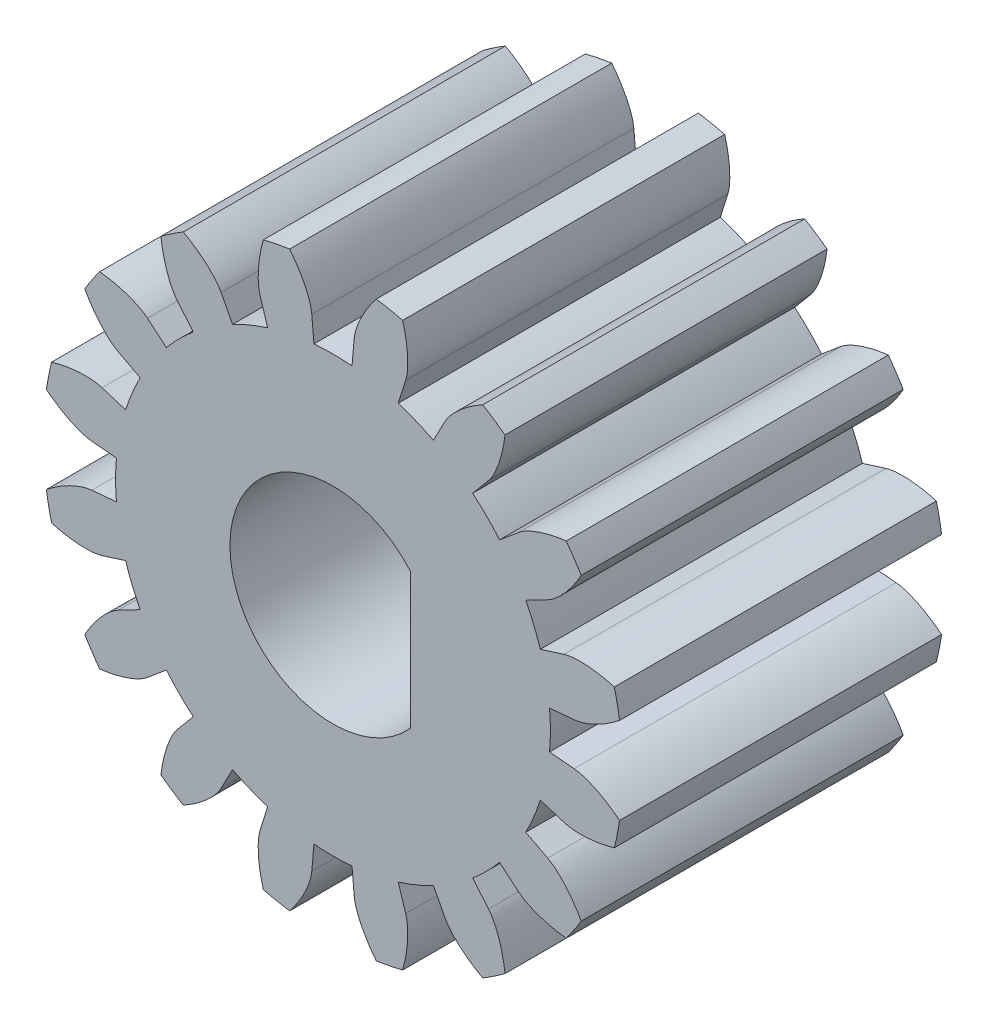
from build123d import *

# Parameters (mm, degrees)
SKETCH_1_R               = 4.5
SKETCH_1_R_2             = 1.5
EXTRUDE_1_DEPTH          = 5
CUT_EXTRUDE_1_DEPTH      = 9.093207028
PATTERN_CIRCULAR_1_DEPTH = 5
SKETCH_2_R               = 1.6
EXTRUDE_2_DEPTH          = 5
CUT_EXTRUDE_2_DEPTH      = 9.037177216


# Read off the part's stored shape, not the designer's step: 阵列(圆周)1
with BuildPart() as part:
    # 草图1 → 凸台-拉伸1 (new body)
    with BuildSketch(Plane.XY):
        Circle(SKETCH_1_R)
        Circle(SKETCH_1_R_2, mode=Mode.SUBTRACT)
    extrude(amount=EXTRUDE_1_DEPTH)

    # 草图1<3> → 切除-拉伸1 (cut, through all)
    with BuildSketch(Plane.XY):
        with BuildLine():
            Line((3.744337803, 0.329074401), (3.362040897, 0.295475903))
            ThreePointArc((3.362040897, 0.295475903), (3.371758668, 0.147879975), (3.375, 0))
            ThreePointArc((3.375, 0), (3.371758668, -0.147879975), (3.362040897, -0.295475903))
            Line((3.362040897, -0.295475903), (3.744337803, -0.329074401))
            add(Edge.make_bspline(
                [(3.744337803, -0.329074401), (3.772879878, -0.331582846), (3.852010051, -0.344515168), (3.998053748, -0.392622231), (4.176593354, -0.48016265), (4.319250266, -0.572875861), (4.413779393, -0.643953083), (4.449506423, -0.672229565)],
                knots=[0, 0, 0, 0, 0, 0.005604068, 0.015718248, 0.029959916, 0.038889728, 0.038889728, 0.038889728, 0.038889728, 0.038889728], degree=4))
            ThreePointArc((4.449506423, -0.672229565), (4.48735885, -0.337061637), (4.5, 0))
            ThreePointArc((4.5, 0), (4.48735885, 0.337061637), (4.449506423, 0.672229565))
            add(Edge.make_bspline(
                [(3.744337803, 0.329074401), (3.772879878, 0.331582846), (3.852010051, 0.344515168), (3.998053748, 0.392622231), (4.176593354, 0.48016265), (4.319250266, 0.572875861), (4.413779393, 0.643953083), (4.449506423, 0.672229565)],
                knots=[0, 0, 0, 0, 0, 0.005604068, 0.015718248, 0.029959916, 0.038889728, 0.038889728, 0.038889728, 0.038889728, 0.038889728], degree=4))
        make_face()
    extrude(amount=CUT_EXTRUDE_1_DEPTH, mode=Mode.SUBTRACT)

    # 阵列(圆周)1 outline → 阵列(圆周)1 (cut)
    with BuildSketch(Plane.XY):
        with BuildLine():
            Line((3.219194505, 1.013613211), (3.58524838, 1.128870939))
            add(Edge.make_bspline(
                [(3.58524838, 1.128870939), (3.612577759, 1.137476016), (3.690633492, 1.155809915), (3.843970051, 1.167253287), (4.042419406, 1.154700636), (4.209697017, 1.123637234), (4.324230618, 1.094145175), (4.368059032, 1.081693254)],
                knots=[0, 0, 0, 0, 0, 0.005604068, 0.015718248, 0.029959916, 0.038889728, 0.038889728, 0.038889728, 0.038889728, 0.038889728], degree=4))
            ThreePointArc((4.368059032, 1.081693254), (4.157457896, 1.722075445), (3.853556797, 2.323811526))
            add(Edge.make_bspline(
                [(3.333385738, 1.736921146), (3.358795236, 1.750161226), (3.426952998, 1.79239094), (3.543470004, 1.892724575), (3.674918824, 2.041925525), (3.771236815, 2.1821738), (3.831370266, 2.284015321), (3.853556797, 2.323811526)],
                knots=[0, 0, 0, 0, 0, 0.005604068, 0.015718248, 0.029959916, 0.038889728, 0.038889728, 0.038889728, 0.038889728, 0.038889728], degree=4))
            Line((3.333385738, 1.736921146), (2.993047039, 1.559581489))
            ThreePointArc((2.993047039, 1.559581489), (3.118093422, 1.291556584), (3.219194505, 1.013613211))
        make_face()
        with BuildLine():
            add(Edge.make_bspline(
                [(3.333385738, -1.736921146), (3.358795236, -1.750161226), (3.426952998, -1.79239094), (3.543470004, -1.892724575), (3.674918824, -2.041925525), (3.771236815, -2.1821738), (3.831370266, -2.284015321), (3.853556797, -2.323811527)],
                knots=[0, 0, 0, 0, 0, 0.005604068, 0.015718248, 0.029959916, 0.038889728, 0.038889728, 0.038889728, 0.038889728, 0.038889728], degree=4))
            ThreePointArc((3.853556797, -2.323811527), (4.157457896, -1.722075445), (4.368059031, -1.081693254))
            add(Edge.make_bspline(
                [(3.58524838, -1.128870939), (3.612577759, -1.137476016), (3.690633492, -1.155809915), (3.843970051, -1.167253287), (4.042419406, -1.154700636), (4.209697017, -1.123637234), (4.324230618, -1.094145175), (4.368059031, -1.081693254)],
                knots=[0, 0, 0, 0, 0, 0.005604068, 0.015718248, 0.029959916, 0.038889728, 0.038889728, 0.038889728, 0.038889728, 0.038889728], degree=4))
            Line((3.58524838, -1.128870939), (3.219194505, -1.013613211))
            ThreePointArc((3.219194505, -1.013613211), (3.118093422, -1.291556584), (2.993047039, -1.559581489))
            Line((2.993047039, -1.559581489), (3.333385738, -1.736921146))
        make_face()
        with BuildLine():
            add(Edge.make_bspline(
                [(2.414955911, -2.880337392), (2.433364467, -2.902293425), (2.480173417, -2.96739144), (2.549425074, -3.104676759), (2.613771217, -3.292823749), (2.649086746, -3.459255559), (2.665669748, -3.576356931), (2.670938081, -3.621614249)],
                knots=[0, 0, 0, 0, 0, 0.005604068, 0.015718248, 0.029959916, 0.038889728, 0.038889728, 0.038889728, 0.038889728, 0.038889728], degree=4))
            ThreePointArc((2.670938081, -3.621614249), (3.181980515, -3.181980515), (3.621614249, -2.670938081))
            add(Edge.make_bspline(
                [(2.880337392, -2.414955911), (2.902293425, -2.433364467), (2.96739144, -2.480173417), (3.104676759, -2.549425074), (3.292823749, -2.613771217), (3.459255559, -2.649086746), (3.576356931, -2.665669748), (3.621614249, -2.670938081)],
                knots=[0, 0, 0, 0, 0, 0.005604068, 0.015718248, 0.029959916, 0.038889728, 0.038889728, 0.038889728, 0.038889728, 0.038889728], degree=4))
            Line((2.880337392, -2.414955911), (2.586254932, -2.168388902))
            ThreePointArc((2.586254932, -2.168388902), (2.386485387, -2.386485387), (2.168388902, -2.586254932))
            Line((2.168388902, -2.586254932), (2.414955911, -2.880337392))
        make_face()
        with BuildLine():
            add(Edge.make_bspline(
                [(1.128870939, -3.58524838), (1.137476016, -3.612577759), (1.155809915, -3.690633492), (1.167253287, -3.843970051), (1.154700636, -4.042419406), (1.123637234, -4.209697017), (1.094145175, -4.324230618), (1.081693254, -4.368059032)],
                knots=[0, 0, 0, 0, 0, 0.005604068, 0.015718248, 0.029959916, 0.038889728, 0.038889728, 0.038889728, 0.038889728, 0.038889728], degree=4))
            ThreePointArc((1.081693254, -4.368059032), (1.722075446, -4.157457896), (2.323811527, -3.853556797))
            add(Edge.make_bspline(
                [(1.736921146, -3.333385738), (1.750161226, -3.358795236), (1.79239094, -3.426952998), (1.892724575, -3.543470004), (2.041925525, -3.674918824), (2.1821738, -3.771236815), (2.284015321, -3.831370266), (2.323811527, -3.853556797)],
                knots=[0, 0, 0, 0, 0, 0.005604068, 0.015718248, 0.029959916, 0.038889728, 0.038889728, 0.038889728, 0.038889728, 0.038889728], degree=4))
            Line((1.736921146, -3.333385738), (1.559581489, -2.993047039))
            ThreePointArc((1.559581489, -2.993047039), (1.291556584, -3.118093422), (1.013613211, -3.219194505))
            Line((1.013613211, -3.219194505), (1.128870939, -3.58524838))
        make_face()
        with BuildLine():
            add(Edge.make_bspline(
                [(-0.329074401, -3.744337803), (-0.331582846, -3.772879878), (-0.344515168, -3.852010051), (-0.392622231, -3.998053748), (-0.48016265, -4.176593354), (-0.572875861, -4.319250266), (-0.643953083, -4.413779393), (-0.672229565, -4.449506423)],
                knots=[0, 0, 0, 0, 0, 0.005604068, 0.015718248, 0.029959916, 0.038889728, 0.038889728, 0.038889728, 0.038889728, 0.038889728], degree=4))
            ThreePointArc((-0.672229565, -4.449506423), (0, -4.5), (0.672229565, -4.449506423))
            add(Edge.make_bspline(
                [(0.329074401, -3.744337803), (0.331582846, -3.772879878), (0.344515168, -3.852010051), (0.392622231, -3.998053748), (0.48016265, -4.176593354), (0.572875861, -4.319250266), (0.643953083, -4.413779393), (0.672229565, -4.449506423)],
                knots=[0, 0, 0, 0, 0, 0.005604068, 0.015718248, 0.029959916, 0.038889728, 0.038889728, 0.038889728, 0.038889728, 0.038889728], degree=4))
            Line((0.329074401, -3.744337803), (0.295475903, -3.362040897))
            ThreePointArc((0.295475903, -3.362040897), (0, -3.375), (-0.295475903, -3.362040897))
            Line((-0.295475903, -3.362040897), (-0.329074401, -3.744337803))
        make_face()
        with BuildLine():
            add(Edge.make_bspline(
                [(-1.736921146, -3.333385738), (-1.750161226, -3.358795236), (-1.79239094, -3.426952998), (-1.892724575, -3.543470004), (-2.041925525, -3.674918824), (-2.1821738, -3.771236815), (-2.284015321, -3.831370266), (-2.323811527, -3.853556797)],
                knots=[0, 0, 0, 0, 0, 0.005604068, 0.015718248, 0.029959916, 0.038889728, 0.038889728, 0.038889728, 0.038889728, 0.038889728], degree=4))
            ThreePointArc((-2.323811527, -3.853556797), (-1.722075446, -4.157457896), (-1.081693254, -4.368059031))
            add(Edge.make_bspline(
                [(-1.128870939, -3.58524838), (-1.137476016, -3.612577759), (-1.155809915, -3.690633492), (-1.167253287, -3.843970051), (-1.154700636, -4.042419406), (-1.123637234, -4.209697017), (-1.094145175, -4.324230618), (-1.081693254, -4.368059031)],
                knots=[0, 0, 0, 0, 0, 0.005604068, 0.015718248, 0.029959916, 0.038889728, 0.038889728, 0.038889728, 0.038889728, 0.038889728], degree=4))
            Line((-1.128870939, -3.58524838), (-1.013613211, -3.219194505))
            ThreePointArc((-1.013613211, -3.219194505), (-1.291556584, -3.118093422), (-1.559581489, -2.993047039))
            Line((-1.559581489, -2.993047039), (-1.736921146, -3.333385738))
        make_face()
        with BuildLine():
            add(Edge.make_bspline(
                [(-2.880337392, -2.414955911), (-2.902293425, -2.433364467), (-2.96739144, -2.480173417), (-3.104676759, -2.549425074), (-3.292823749, -2.613771217), (-3.459255559, -2.649086746), (-3.576356931, -2.665669748), (-3.621614249, -2.670938081)],
                knots=[0, 0, 0, 0, 0, 0.005604068, 0.015718248, 0.029959916, 0.038889728, 0.038889728, 0.038889728, 0.038889728, 0.038889728], degree=4))
            ThreePointArc((-3.621614249, -2.670938081), (-3.181980515, -3.181980515), (-2.670938081, -3.621614249))
            add(Edge.make_bspline(
                [(-2.414955911, -2.880337392), (-2.433364467, -2.902293425), (-2.480173417, -2.96739144), (-2.549425074, -3.104676759), (-2.613771217, -3.292823749), (-2.649086746, -3.459255559), (-2.665669748, -3.576356931), (-2.670938081, -3.621614249)],
                knots=[0, 0, 0, 0, 0, 0.005604068, 0.015718248, 0.029959916, 0.038889728, 0.038889728, 0.038889728, 0.038889728, 0.038889728], degree=4))
            Line((-2.414955911, -2.880337392), (-2.168388902, -2.586254932))
            ThreePointArc((-2.168388902, -2.586254932), (-2.386485387, -2.386485387), (-2.586254932, -2.168388902))
            Line((-2.586254932, -2.168388902), (-2.880337392, -2.414955911))
        make_face()
        with BuildLine():
            add(Edge.make_bspline(
                [(-3.58524838, -1.128870939), (-3.612577759, -1.137476016), (-3.690633492, -1.155809915), (-3.843970051, -1.167253287), (-4.042419406, -1.154700636), (-4.209697017, -1.123637234), (-4.324230618, -1.094145175), (-4.368059032, -1.081693254)],
                knots=[0, 0, 0, 0, 0, 0.005604068, 0.015718248, 0.029959916, 0.038889728, 0.038889728, 0.038889728, 0.038889728, 0.038889728], degree=4))
            ThreePointArc((-4.368059032, -1.081693254), (-4.157457896, -1.722075446), (-3.853556797, -2.323811527))
            add(Edge.make_bspline(
                [(-3.333385738, -1.736921146), (-3.358795236, -1.750161226), (-3.426952998, -1.79239094), (-3.543470004, -1.892724575), (-3.674918824, -2.041925525), (-3.771236815, -2.1821738), (-3.831370266, -2.284015321), (-3.853556797, -2.323811527)],
                knots=[0, 0, 0, 0, 0, 0.005604068, 0.015718248, 0.029959916, 0.038889728, 0.038889728, 0.038889728, 0.038889728, 0.038889728], degree=4))
            Line((-3.333385738, -1.736921146), (-2.993047039, -1.559581489))
            ThreePointArc((-2.993047039, -1.559581489), (-3.118093422, -1.291556584), (-3.219194505, -1.013613211))
            Line((-3.219194505, -1.013613211), (-3.58524838, -1.128870939))
        make_face()
        with BuildLine():
            add(Edge.make_bspline(
                [(-3.744337803, 0.329074401), (-3.772879878, 0.331582846), (-3.852010051, 0.344515168), (-3.998053748, 0.392622231), (-4.176593354, 0.48016265), (-4.319250266, 0.572875861), (-4.413779393, 0.643953083), (-4.449506423, 0.672229565)],
                knots=[0, 0, 0, 0, 0, 0.005604068, 0.015718248, 0.029959916, 0.038889728, 0.038889728, 0.038889728, 0.038889728, 0.038889728], degree=4))
            ThreePointArc((-4.449506423, 0.672229565), (-4.5, 0), (-4.449506423, -0.672229565))
            add(Edge.make_bspline(
                [(-3.744337803, -0.329074401), (-3.772879878, -0.331582846), (-3.852010051, -0.344515168), (-3.998053748, -0.392622231), (-4.176593354, -0.48016265), (-4.319250266, -0.572875861), (-4.413779393, -0.643953083), (-4.449506423, -0.672229565)],
                knots=[0, 0, 0, 0, 0, 0.005604068, 0.015718248, 0.029959916, 0.038889728, 0.038889728, 0.038889728, 0.038889728, 0.038889728], degree=4))
            Line((-3.744337803, -0.329074401), (-3.362040897, -0.295475903))
            ThreePointArc((-3.362040897, -0.295475903), (-3.375, 0), (-3.362040897, 0.295475903))
            Line((-3.362040897, 0.295475903), (-3.744337803, 0.329074401))
        make_face()
        with BuildLine():
            add(Edge.make_bspline(
                [(-3.333385738, 1.736921146), (-3.358795236, 1.750161226), (-3.426952998, 1.79239094), (-3.543470004, 1.892724575), (-3.674918824, 2.041925525), (-3.771236815, 2.1821738), (-3.831370266, 2.284015321), (-3.853556797, 2.323811527)],
                knots=[0, 0, 0, 0, 0, 0.005604068, 0.015718248, 0.029959916, 0.038889728, 0.038889728, 0.038889728, 0.038889728, 0.038889728], degree=4))
            ThreePointArc((-3.853556797, 2.323811527), (-4.157457896, 1.722075446), (-4.368059032, 1.081693254))
            add(Edge.make_bspline(
                [(-3.58524838, 1.128870939), (-3.612577759, 1.137476016), (-3.690633492, 1.155809915), (-3.843970051, 1.167253287), (-4.042419406, 1.154700636), (-4.209697017, 1.123637234), (-4.324230618, 1.094145175), (-4.368059032, 1.081693254)],
                knots=[0, 0, 0, 0, 0, 0.005604068, 0.015718248, 0.029959916, 0.038889728, 0.038889728, 0.038889728, 0.038889728, 0.038889728], degree=4))
            Line((-3.58524838, 1.128870939), (-3.219194505, 1.013613211))
            ThreePointArc((-3.219194505, 1.013613211), (-3.118093422, 1.291556584), (-2.993047039, 1.559581489))
            Line((-2.993047039, 1.559581489), (-3.333385738, 1.736921146))
        make_face()
        with BuildLine():
            add(Edge.make_bspline(
                [(-2.414955911, 2.880337392), (-2.433364467, 2.902293425), (-2.480173417, 2.96739144), (-2.549425074, 3.104676759), (-2.613771217, 3.292823749), (-2.649086746, 3.459255559), (-2.665669748, 3.576356931), (-2.670938081, 3.621614249)],
                knots=[0, 0, 0, 0, 0, 0.005604068, 0.015718248, 0.029959916, 0.038889728, 0.038889728, 0.038889728, 0.038889728, 0.038889728], degree=4))
            ThreePointArc((-2.670938081, 3.621614249), (-3.181980515, 3.181980515), (-3.621614249, 2.670938081))
            add(Edge.make_bspline(
                [(-2.880337392, 2.414955911), (-2.902293425, 2.433364467), (-2.96739144, 2.480173417), (-3.104676759, 2.549425074), (-3.292823749, 2.613771217), (-3.459255559, 2.649086746), (-3.576356931, 2.665669748), (-3.621614249, 2.670938081)],
                knots=[0, 0, 0, 0, 0, 0.005604068, 0.015718248, 0.029959916, 0.038889728, 0.038889728, 0.038889728, 0.038889728, 0.038889728], degree=4))
            Line((-2.880337392, 2.414955911), (-2.586254932, 2.168388902))
            ThreePointArc((-2.586254932, 2.168388902), (-2.386485387, 2.386485387), (-2.168388902, 2.586254932))
            Line((-2.168388902, 2.586254932), (-2.414955911, 2.880337392))
        make_face()
        with BuildLine():
            add(Edge.make_bspline(
                [(-1.128870939, 3.58524838), (-1.137476016, 3.612577759), (-1.155809915, 3.690633492), (-1.167253287, 3.843970051), (-1.154700636, 4.042419406), (-1.123637234, 4.209697017), (-1.094145175, 4.324230618), (-1.081693254, 4.368059032)],
                knots=[0, 0, 0, 0, 0, 0.005604068, 0.015718248, 0.029959916, 0.038889728, 0.038889728, 0.038889728, 0.038889728, 0.038889728], degree=4))
            ThreePointArc((-1.081693254, 4.368059032), (-1.722075446, 4.157457896), (-2.323811527, 3.853556797))
            add(Edge.make_bspline(
                [(-1.736921146, 3.333385738), (-1.750161226, 3.358795236), (-1.79239094, 3.426952998), (-1.892724575, 3.543470004), (-2.041925525, 3.674918824), (-2.1821738, 3.771236815), (-2.284015321, 3.831370266), (-2.323811527, 3.853556797)],
                knots=[0, 0, 0, 0, 0, 0.005604068, 0.015718248, 0.029959916, 0.038889728, 0.038889728, 0.038889728, 0.038889728, 0.038889728], degree=4))
            Line((-1.736921146, 3.333385738), (-1.559581489, 2.993047039))
            ThreePointArc((-1.559581489, 2.993047039), (-1.291556584, 3.118093422), (-1.013613211, 3.219194505))
            Line((-1.013613211, 3.219194505), (-1.128870939, 3.58524838))
        make_face()
        with BuildLine():
            add(Edge.make_bspline(
                [(0.329074401, 3.744337803), (0.331582846, 3.772879878), (0.344515168, 3.852010051), (0.392622231, 3.998053748), (0.48016265, 4.176593354), (0.572875861, 4.319250266), (0.643953083, 4.413779393), (0.672229565, 4.449506423)],
                knots=[0, 0, 0, 0, 0, 0.005604068, 0.015718248, 0.029959916, 0.038889728, 0.038889728, 0.038889728, 0.038889728, 0.038889728], degree=4))
            ThreePointArc((0.672229565, 4.449506423), (0, 4.5), (-0.672229565, 4.449506423))
            add(Edge.make_bspline(
                [(-0.329074401, 3.744337803), (-0.331582846, 3.772879878), (-0.344515168, 3.852010051), (-0.392622231, 3.998053748), (-0.48016265, 4.176593354), (-0.572875861, 4.319250266), (-0.643953083, 4.413779393), (-0.672229565, 4.449506423)],
                knots=[0, 0, 0, 0, 0, 0.005604068, 0.015718248, 0.029959916, 0.038889728, 0.038889728, 0.038889728, 0.038889728, 0.038889728], degree=4))
            Line((-0.329074401, 3.744337803), (-0.295475903, 3.362040897))
            ThreePointArc((-0.295475903, 3.362040897), (0, 3.375), (0.295475903, 3.362040897))
            Line((0.295475903, 3.362040897), (0.329074401, 3.744337803))
        make_face()
        with BuildLine():
            add(Edge.make_bspline(
                [(1.736921146, 3.333385738), (1.750161226, 3.358795236), (1.79239094, 3.426952998), (1.892724575, 3.543470004), (2.041925525, 3.674918824), (2.1821738, 3.771236815), (2.284015321, 3.831370266), (2.323811527, 3.853556797)],
                knots=[0, 0, 0, 0, 0, 0.005604068, 0.015718248, 0.029959916, 0.038889728, 0.038889728, 0.038889728, 0.038889728, 0.038889728], degree=4))
            ThreePointArc((2.323811527, 3.853556797), (1.722075446, 4.157457896), (1.081693254, 4.368059031))
            add(Edge.make_bspline(
                [(1.128870939, 3.58524838), (1.137476016, 3.612577759), (1.155809915, 3.690633492), (1.167253287, 3.843970051), (1.154700636, 4.042419406), (1.123637234, 4.209697017), (1.094145175, 4.324230618), (1.081693254, 4.368059031)],
                knots=[0, 0, 0, 0, 0, 0.005604068, 0.015718248, 0.029959916, 0.038889728, 0.038889728, 0.038889728, 0.038889728, 0.038889728], degree=4))
            Line((1.128870939, 3.58524838), (1.013613211, 3.219194505))
            ThreePointArc((1.013613211, 3.219194505), (1.291556584, 3.118093422), (1.559581489, 2.993047039))
            Line((1.559581489, 2.993047039), (1.736921146, 3.333385738))
        make_face()
        with BuildLine():
            add(Edge.make_bspline(
                [(2.880337392, 2.414955911), (2.902293425, 2.433364467), (2.96739144, 2.480173417), (3.104676759, 2.549425074), (3.292823749, 2.613771217), (3.459255559, 2.649086746), (3.576356931, 2.665669748), (3.621614249, 2.670938081)],
                knots=[0, 0, 0, 0, 0, 0.005604068, 0.015718248, 0.029959916, 0.038889728, 0.038889728, 0.038889728, 0.038889728, 0.038889728], degree=4))
            ThreePointArc((3.621614249, 2.670938081), (3.181980515, 3.181980515), (2.670938081, 3.621614249))
            add(Edge.make_bspline(
                [(2.414955911, 2.880337392), (2.433364467, 2.902293425), (2.480173417, 2.96739144), (2.549425074, 3.104676759), (2.613771217, 3.292823749), (2.649086746, 3.459255559), (2.665669748, 3.576356931), (2.670938081, 3.621614249)],
                knots=[0, 0, 0, 0, 0, 0.005604068, 0.015718248, 0.029959916, 0.038889728, 0.038889728, 0.038889728, 0.038889728, 0.038889728], degree=4))
            Line((2.414955911, 2.880337392), (2.168388902, 2.586254932))
            ThreePointArc((2.168388902, 2.586254932), (2.386485387, 2.386485387), (2.586254932, 2.168388902))
            Line((2.586254932, 2.168388902), (2.880337392, 2.414955911))
        make_face()
    extrude(amount=PATTERN_CIRCULAR_1_DEPTH, mode=Mode.SUBTRACT)

    # 草图2 → 凸台-拉伸2 (add, through all)
    with BuildSketch(Plane.XY.offset(5)):
        Circle(SKETCH_2_R)
    extrude(amount=-EXTRUDE_2_DEPTH)

    # 草图2<3> → 切除-拉伸2 (cut, through all)
    with BuildSketch(Plane.XY.offset(5)):
        with BuildLine():
            Line((1.2, -1.058300524), (1.2, 1.058300524))
            ThreePointArc((1.2, 1.058300524), (-1.6, 0), (1.2, -1.058300524))
        make_face()
    extrude(amount=-CUT_EXTRUDE_2_DEPTH, mode=Mode.SUBTRACT)


solid = part.part
